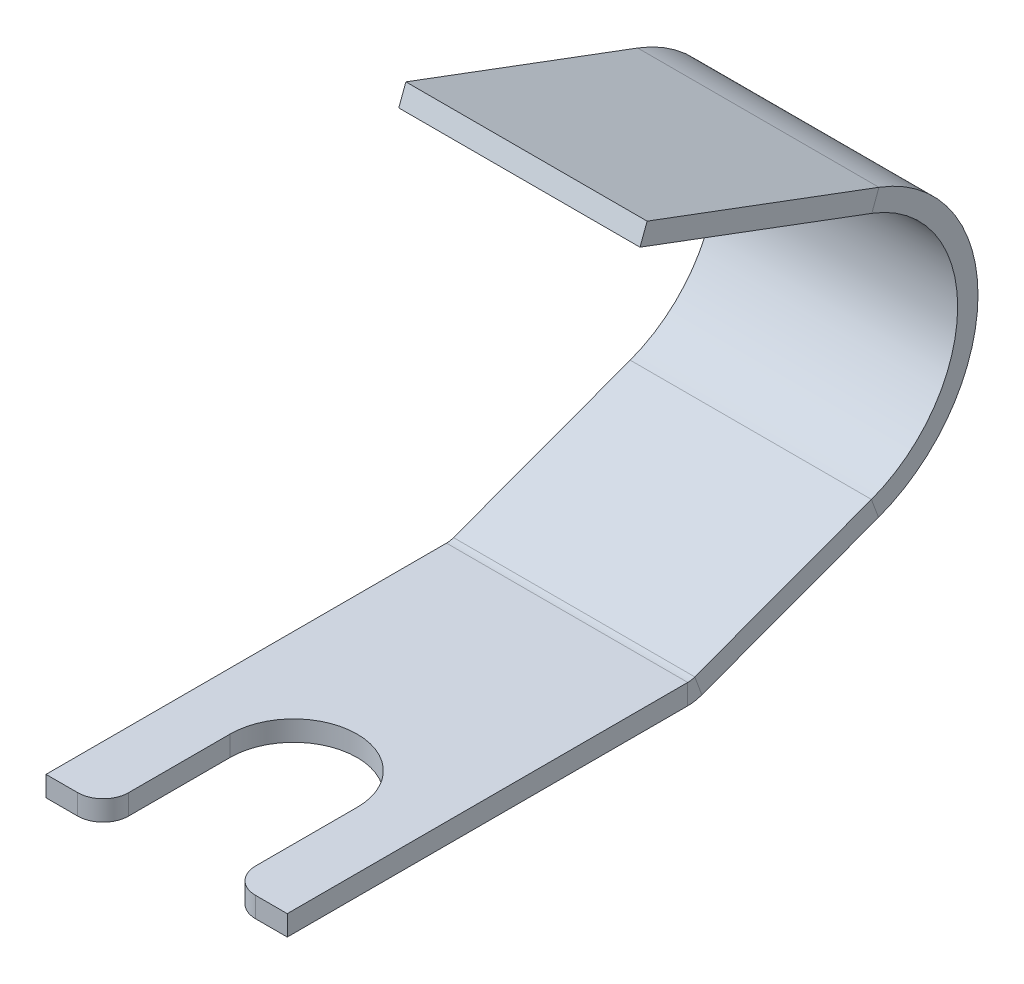
from build123d import *

# Parameters (mm, degrees)
SM_START               = -47.5
SM_BASE_FLANGE_1_DEPTH = 95
CUT_EXTRUDE_1_DEPTH    = 278.911623222
FILLET_1_R             = 10


# Read off the part's stored shape, not the designer's step: 基体-法兰1
with BuildPart() as part:
    # 基体-法兰1 outline → 基体-法兰1 (new body)
    with BuildSketch(Plane(origin=(0, 0, 0), x_dir=(0, 0, -1), z_dir=(1, 0, 0)).offset(SM_START)):
        with BuildLine():
            Line((20.994484106, 56.207042593), (-70.293536893, 90.304992202))
            Line((-70.293536893, 90.304992202), (-73.092801441, 82.810719856))
            Line((-73.092801441, 82.810719856), (18.195219559, 48.712770248))
            ThreePointArc((18.195219559, 48.712770248), (51.999935218, -0.082081346), (18.041344088, -48.769969279))
            Line((18.041344088, -48.769969279), (-51.521246849, -74.503072197))
            ThreePointArc((-51.521246849, -74.503072197), (-52.886976122, -74.874788174), (-54.296838247, -75))
            Line((-54.296838247, -75), (-212, -75))
            Line((-212, -75), (-212, -83))
            Line((-212, -83), (-54.296838247, -83))
            ThreePointArc((-54.296838247, -83), (-51.477113996, -82.749576348), (-48.74565545, -82.006144394))
            Line((-48.74565545, -82.006144394), (20.816935486, -56.273041476))
            ThreePointArc((20.816935486, -56.273041476), (59.999925251, -0.094709246), (20.994484106, 56.207042593))
        make_face()
    extrude(amount=SM_BASE_FLANGE_1_DEPTH)

    # 草图6 → 切除-拉伸1 (cut, through all)
    with BuildSketch(Plane.XZ.offset(83)):
        with BuildLine():
            Line((-25, 162), (-25, 212))
            Line((-25, 212), (25, 212))
            Line((25, 212), (25, 162))
            ThreePointArc((25, 162), (0, 137), (-25, 162))
        make_face()
    extrude(amount=-CUT_EXTRUDE_1_DEPTH, mode=Mode.SUBTRACT)

    # 圆角1
    fillet_1_edges = [part.edges().sort_by_distance(p)[0] for p in [
        (-25, -79, 212),
        (25, -79, 212),
    ]]
    fillet(fillet_1_edges, radius=FILLET_1_R)


solid = part.part
